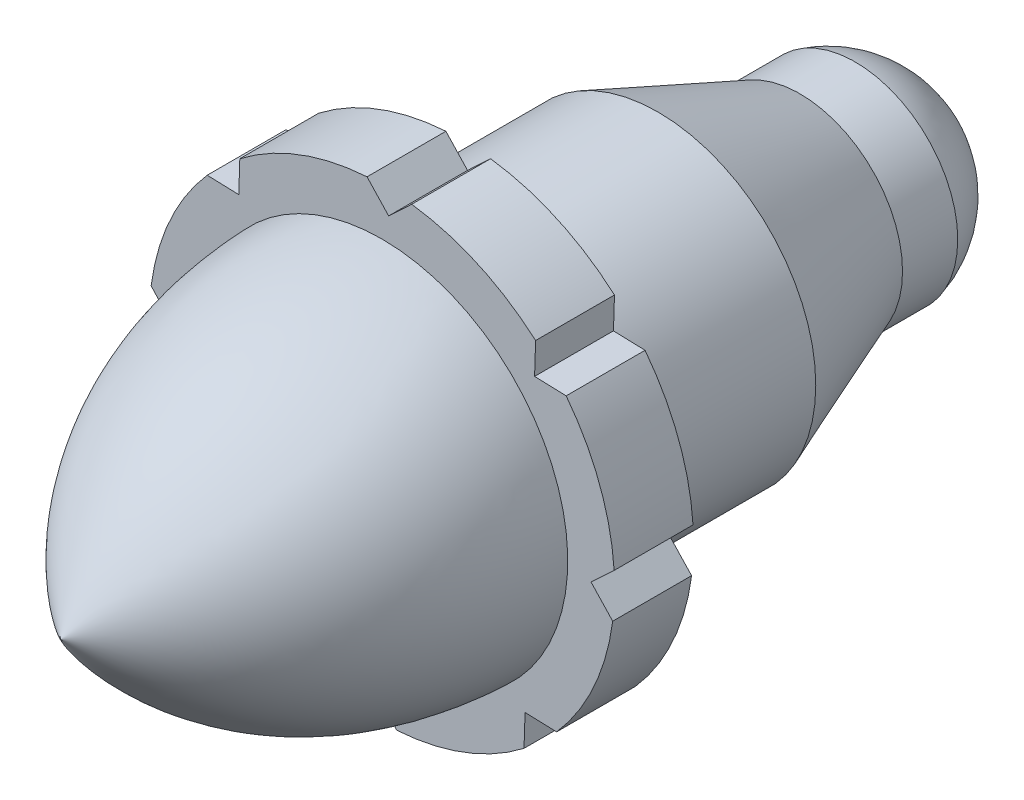
from build123d import *

# Parameters (mm, degrees)
DOME1_FACE_RADIUS = 3.302
DOME1_HEIGHT      = 2.54
SEEDCUT_DEPTH     = 21.698272826
CIRPATTERN1_COUNT = 8


# Read off the part's stored shape, not the designer's step: Cut-Revolve-Thin4
with BuildPart() as part:
    # Sketch1 → Revolve1 (revolve)
    with BuildSketch(Plane(origin=(0, 0, 0), x_dir=(0, 0, -1), z_dir=(1, 0, 0)), mode=Mode.PRIVATE) as revolve1_sk:
        Polygon((-2.54, 0), (-2.54, 7.493), (0, 7.493), (0, 5.08), (12.7, 5.08), (12.7, 0), align=None)
    revolve(revolve1_sk.sketch.rotate(Axis((0, 0, 12.072762836), (0, 0, -1)), 90), axis=Axis((0, 0, 12.072762836), (0, 0, -1)))

    # Sketch3 → Revolve2 (revolve)
    with BuildSketch(Plane(origin=(0, 0, 0), x_dir=(0, 0, -1), z_dir=(1, 0, 0))):
        with BuildLine():
            Line((-12.887595566, 0), (-2.54, 0))
            Line((-2.54, 0), (-2.54, 5.984091271))
            add(Edge.make_bspline(
                [(-2.54, 5.984091271), (-9.10319215, 5.770912184), (-12.887595566, 0)],
                knots=[0, 0, 0, 1, 1, 1], degree=2))
        make_face()
    revolve(axis=Axis((0, 0, 12.072762836), (0, 0, 1)))

    # Cut-Revolve-Thin4 outline → Cut-Revolve-Thin4 (revolve, cut)
    with BuildSketch(Plane.XZ):
        Polygon((3.302, -10.922), (3.302, -12.7), (5.08, -12.7), (5.08, -6.35), align=None)
    revolve(axis=Axis((0, 0, 0), (0, 0, 1)), mode=Mode.SUBTRACT)

    # Dome1: a dome of height H over a round flat face of radius A is a cap of a sphere of radius (A * A + H * H) / (2 * H)
    dome1_r = (DOME1_FACE_RADIUS * DOME1_FACE_RADIUS + DOME1_HEIGHT * DOME1_HEIGHT) / (2 * DOME1_HEIGHT)
    dome1_base = Plane((0, 0, -12.7), z_dir=(0, 0, -1))
    with Locations(dome1_base.offset(DOME1_HEIGHT - dome1_r)):
        dome1_ball = Sphere(dome1_r, mode=Mode.PRIVATE)
    add(split(dome1_ball, bisect_by=dome1_base, keep=Keep.TOP, mode=Mode.PRIVATE))

    # Sketch6 → SeedCut (cut, through all)
    with BuildSketch(Plane.XY.offset(2.54)):
        with BuildLine():
            Line((0.217011402, 6.735050359), (0.959619925, 7.431297235))
            ThreePointArc((0.959619925, 7.431297235), (0.241308217, 7.489113388), (-0.479235475, 7.477658882))
            Line((-0.479235475, 7.477658882), (0.217011402, 6.735050359))
        make_face()
    seedcut = extrude(amount=-SEEDCUT_DEPTH, mode=Mode.SUBTRACT)

    # CirPattern1: SeedCut ×8 about axis
    cirpattern1_axis = Axis((0, 0, 0), (0, 0, 1))
    for i in range(1, CIRPATTERN1_COUNT):
        add(seedcut.rotate(cirpattern1_axis, i * 360 / CIRPATTERN1_COUNT), mode=Mode.SUBTRACT)


solid = part.part
